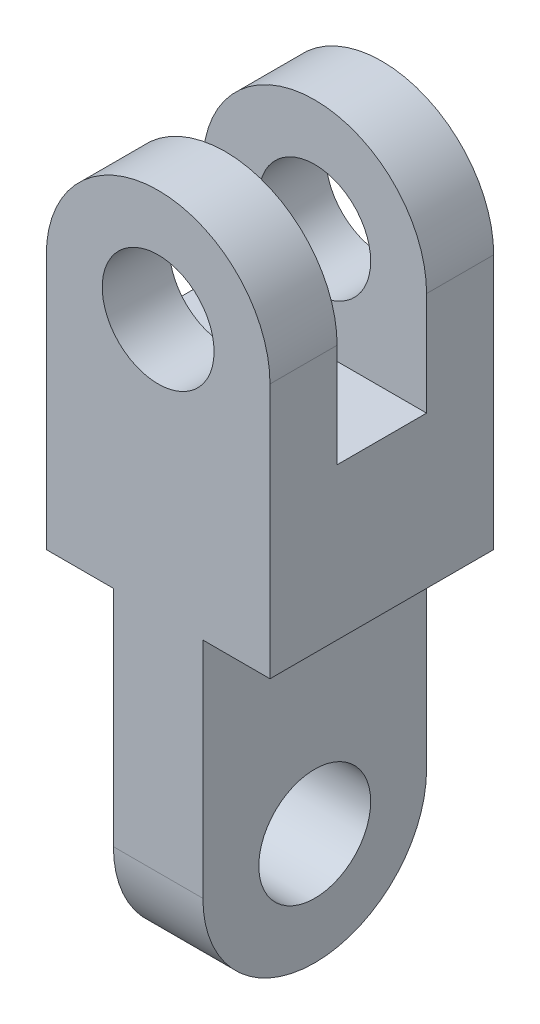
from build123d import *

# Parameters (mm, degrees)
BOSS_EXTRUDE1_DEPTH        = 50
BOSS_EXTRUDE1_DEPTH_BACK   = 50
CUT_EXTRUDE1_DEPTH         = 199.584759445
F_25_0_50_DIAMETER_HOLE1_D = 50
SKETCH7_W                  = 40
SKETCH7_H                  = 50
REVOLVE1_ANGLE             = 180
F_1_0_50_DIAMETER_HOLE1_D  = 50


with BuildPart() as part:
    # Sketch1 → Boss-Extrude1 (new, two sides: drawn at the far end of the back side and taken through both)
    with BuildSketch(Plane.XY.offset(-BOSS_EXTRUDE1_DEPTH_BACK)):
        with BuildLine():
            Line((20, 0), (50, 0))
            Line((50, 0), (50, 114.121621622))
            ThreePointArc((50, 114.121621622), (0, 164.121621622), (-50, 114.121621622))
            Line((-50, 114.121621622), (-50, 0))
            Line((-50, 0), (-20, 0))
            Line((-20, 0), (-20, -100))
            Line((-20, -100), (20, -100))
            Line((20, -100), (20, 0))
        make_face()
    extrude(amount=BOSS_EXTRUDE1_DEPTH + BOSS_EXTRUDE1_DEPTH_BACK)

    # Sketch4 → Cut-Extrude1 (cut, through all)
    with BuildSketch(Plane(origin=(50, 0, 0), x_dir=(0, 0, -1), z_dir=(1, 0, 0))):
        Polygon((-20, 114.121621622), (-20, 67.847884716), (20, 67.847884716), (20, 168.662891807), (-20, 168.662891807), align=None)
    extrude(amount=-CUT_EXTRUDE1_DEPTH, mode=Mode.SUBTRACT)

    # Ø25.0 (50) Diameter Hole1 (through all)
    with Locations(Plane.XY.offset(50)):
        with Locations((0, 114.121621622)):
            Hole(F_25_0_50_DIAMETER_HOLE1_D / 2)

    # Sketch7 → Revolve1 (revolve)
    with BuildSketch(Plane.XZ.offset(100)):
        with Locations((0, 25)):
            Rectangle(SKETCH7_W, SKETCH7_H)
    revolve(axis=Axis((20, -100, 0), (1, 0, 0)), revolution_arc=REVOLVE1_ANGLE)

    # Ø1.0 (50) Diameter Hole1 (through all)
    with Locations(Plane(origin=(20, 0, 0), x_dir=(0, 0, -1), z_dir=(1, 0, 0))):
        with Locations((0, -100)):
            Hole(F_1_0_50_DIAMETER_HOLE1_D / 2)


solid = part.part
